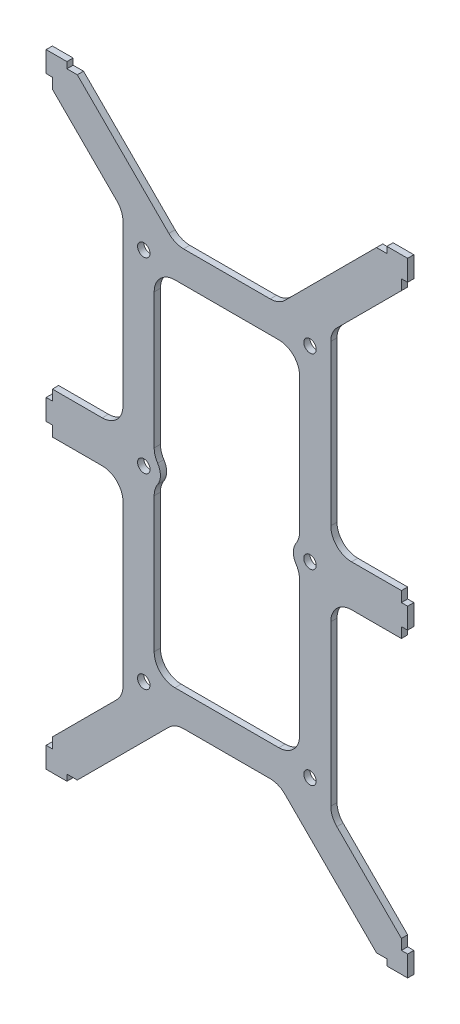
from build123d import *

# Parameters (mm, degrees)
SZKIC1_R                    = 3
DODANIE_WYCI_GNI_CIE1_DEPTH = 3


with BuildPart() as part:
    # Szkic1 → Dodanie-wyciągnięcie1 (new body)
    with BuildSketch(Plane.XY):
        with BuildLine():
            Line((-551.440279355, 234.881586878), (-551.440279355, 224.881586878))
            Line((-551.440279355, 224.881586878), (-548.440279355, 224.881586878))
            Line((-548.440279355, 224.881586878), (-548.440279355, 219.881586878))
            Line((-548.440279355, 219.881586878), (-517.369211543, 188.810519066))
            ThreePointArc((-517.369211543, 188.810519066), (-515.20148403, 185.566285578), (-514.440279355, 181.739451254))
            Line((-514.440279355, 181.739451254), (-514.440279355, 104.881586878))
            ThreePointArc((-514.440279355, 104.881586878), (-517.369211543, 97.810519066), (-524.440279355, 94.881586878))
            Line((-524.440279355, 94.881586878), (-548.440279355, 94.881586878))
            Line((-548.440279355, 94.881586878), (-548.440279355, 89.881586878))
            Line((-548.440279355, 89.881586878), (-551.440279355, 89.881586878))
            Line((-551.440279355, 89.881586878), (-551.440279355, 84.881586878))
            Line((-551.440279355, 84.881586878), (-551.440279355, 79.881586878))
            Line((-551.440279355, 79.881586878), (-548.440279355, 79.881586878))
            Line((-548.440279355, 79.881586878), (-548.440279355, 74.881586878))
            Line((-548.440279355, 74.881586878), (-524.440279355, 74.881586878))
            ThreePointArc((-524.440279355, 74.881586878), (-517.369211543, 71.95265469), (-514.440279355, 64.881586878))
            Line((-514.440279355, 64.881586878), (-514.440279355, -11.976277498))
            ThreePointArc((-514.440279355, -11.976277498), (-515.20148403, -15.803111822), (-517.369211543, -19.04734531))
            Line((-517.369211543, -19.04734531), (-548.440279355, -50.118413122))
            Line((-548.440279355, -50.118413122), (-548.440279355, -55.118413122))
            Line((-548.440279355, -55.118413122), (-551.440279355, -55.118413122))
            Line((-551.440279355, -55.118413122), (-551.440279355, -65.118413122))
            Line((-551.440279355, -65.118413122), (-541.440279355, -65.118413122))
            Line((-541.440279355, -65.118413122), (-541.440279355, -62.118413122))
            Line((-541.440279355, -62.118413122), (-536.440279355, -62.118413122))
            Line((-536.440279355, -62.118413122), (-492.369211543, -18.04734531))
            ThreePointArc((-492.369211543, -18.04734531), (-489.124978055, -15.879617797), (-485.298143731, -15.118413122))
            Line((-485.298143731, -15.118413122), (-464.440279355, -15.118413122))
            Line((-464.440279355, -15.118413122), (-443.582414979, -15.118413122))
            ThreePointArc((-443.582414979, -15.118413122), (-439.755580655, -15.879617797), (-436.511347167, -18.04734531))
            Line((-436.511347167, -18.04734531), (-392.440279355, -62.118413122))
            Line((-392.440279355, -62.118413122), (-387.440279355, -62.118413122))
            Line((-387.440279355, -62.118413122), (-387.440279355, -65.118413122))
            Line((-387.440279355, -65.118413122), (-377.440279355, -65.118413122))
            Line((-377.440279355, -65.118413122), (-377.440279355, -55.118413122))
            Line((-377.440279355, -55.118413122), (-380.440279355, -55.118413122))
            Line((-380.440279355, -55.118413122), (-380.440279355, -50.118413122))
            Line((-380.440279355, -50.118413122), (-411.511347167, -19.04734531))
            ThreePointArc((-411.511347167, -19.04734531), (-413.67907468, -15.803111822), (-414.440279355, -11.976277498))
            Line((-414.440279355, -11.976277498), (-414.440279355, 64.881586878))
            ThreePointArc((-414.440279355, 64.881586878), (-411.511347167, 71.95265469), (-404.440279355, 74.881586878))
            Line((-404.440279355, 74.881586878), (-380.440279355, 74.881586878))
            Line((-380.440279355, 74.881586878), (-380.440279355, 79.881586878))
            Line((-380.440279355, 79.881586878), (-377.440279355, 79.881586878))
            Line((-377.440279355, 79.881586878), (-377.440279355, 84.881586878))
            Line((-377.440279355, 84.881586878), (-377.440279355, 89.881586878))
            Line((-377.440279355, 89.881586878), (-380.440279355, 89.881586878))
            Line((-380.440279355, 89.881586878), (-380.440279355, 94.881586878))
            Line((-380.440279355, 94.881586878), (-404.440279355, 94.881586878))
            ThreePointArc((-404.440279355, 94.881586878), (-411.511347167, 97.810519066), (-414.440279355, 104.881586878))
            Line((-414.440279355, 104.881586878), (-414.440279355, 181.739451254))
            ThreePointArc((-414.440279355, 181.739451254), (-413.67907468, 185.566285578), (-411.511347167, 188.810519066))
            Line((-411.511347167, 188.810519066), (-380.440279355, 219.881586878))
            Line((-380.440279355, 219.881586878), (-380.440279355, 224.881586878))
            Line((-380.440279355, 224.881586878), (-377.440279355, 224.881586878))
            Line((-377.440279355, 224.881586878), (-377.440279355, 234.881586878))
            Line((-377.440279355, 234.881586878), (-387.440279355, 234.881586878))
            Line((-387.440279355, 234.881586878), (-387.440279355, 231.881586878))
            Line((-387.440279355, 231.881586878), (-392.440279355, 231.881586878))
            Line((-392.440279355, 231.881586878), (-436.511347167, 187.810519066))
            ThreePointArc((-436.511347167, 187.810519066), (-439.755580655, 185.642791553), (-443.582414979, 184.881586878))
            Line((-443.582414979, 184.881586878), (-464.440279355, 184.881586878))
            Line((-464.440279355, 184.881586878), (-485.298143731, 184.881586878))
            ThreePointArc((-485.298143731, 184.881586878), (-489.124978055, 185.642791553), (-492.369211543, 187.810519066))
            Line((-492.369211543, 187.810519066), (-536.440279355, 231.881586878))
            Line((-536.440279355, 231.881586878), (-541.440279355, 231.881586878))
            Line((-541.440279355, 231.881586878), (-541.440279355, 234.881586878))
            Line((-541.440279355, 234.881586878), (-551.440279355, 234.881586878))
        make_face()
        with Locations((-504.440279355, 174.881586878)):
            Circle(SZKIC1_R, mode=Mode.SUBTRACT)
        with Locations((-424.440279355, 174.881586878)):
            Circle(SZKIC1_R, mode=Mode.SUBTRACT)
        with Locations((-504.440279355, -5.118413122)):
            Circle(SZKIC1_R, mode=Mode.SUBTRACT)
        with Locations((-424.440279355, -5.118413122)):
            Circle(SZKIC1_R, mode=Mode.SUBTRACT)
        with BuildLine():
            Line((-499.440279355, 159.881586878), (-499.440279355, 94.831461249))
            ThreePointArc((-499.440279355, 94.831461249), (-499.014550433, 91.944709903), (-497.773612688, 89.303753265))
            ThreePointArc((-497.773612688, 89.303753265), (-496.780862493, 87.190987955), (-496.440279355, 84.881586878))
            ThreePointArc((-496.440279355, 84.881586878), (-496.780862493, 82.572185801), (-497.773612688, 80.459420491))
            ThreePointArc((-497.773612688, 80.459420491), (-499.014550433, 77.818463853), (-499.440279355, 74.931712507))
            Line((-499.440279355, 74.931712507), (-499.440279355, 9.881586878))
            ThreePointArc((-499.440279355, 9.881586878), (-496.511347167, 2.810519066), (-489.440279355, -0.118413122))
            Line((-489.440279355, -0.118413122), (-464.440279355, -0.118413122))
            Line((-464.440279355, -0.118413122), (-439.440279355, -0.118413122))
            ThreePointArc((-439.440279355, -0.118413122), (-432.369211543, 2.810519066), (-429.440279355, 9.881586878))
            Line((-429.440279355, 9.881586878), (-429.440279355, 74.931712507))
            ThreePointArc((-429.440279355, 74.931712507), (-429.866008277, 77.818463853), (-431.106946022, 80.459420491))
            ThreePointArc((-431.106946022, 80.459420491), (-432.099696217, 82.572185801), (-432.440279355, 84.881586878))
            ThreePointArc((-432.440279355, 84.881586878), (-432.099696217, 87.190987955), (-431.106946022, 89.303753265))
            ThreePointArc((-431.106946022, 89.303753265), (-429.866008277, 91.944709903), (-429.440279355, 94.831461249))
            Line((-429.440279355, 94.831461249), (-429.440279355, 159.881586878))
            ThreePointArc((-429.440279355, 159.881586878), (-432.369211543, 166.95265469), (-439.440279355, 169.881586878))
            Line((-439.440279355, 169.881586878), (-464.440279355, 169.881586878))
            Line((-464.440279355, 169.881586878), (-489.440279355, 169.881586878))
            ThreePointArc((-489.440279355, 169.881586878), (-496.511347167, 166.95265469), (-499.440279355, 159.881586878))
        make_face(mode=Mode.SUBTRACT)
        with BuildLine():
            ThreePointArc((-501.440279355, 84.881586878), (-504.440279355, 87.881586878), (-507.440279355, 84.881586878))
            ThreePointArc((-507.440279355, 84.881586878), (-504.440279355, 81.881586878), (-501.440279355, 84.881586878))
        make_face(mode=Mode.SUBTRACT)
        with BuildLine():
            ThreePointArc((-421.440279355, 84.881586878), (-424.440279355, 87.881586878), (-427.440279355, 84.881586878))
            ThreePointArc((-427.440279355, 84.881586878), (-424.440279355, 81.881586878), (-421.440279355, 84.881586878))
        make_face(mode=Mode.SUBTRACT)
    extrude(amount=DODANIE_WYCI_GNI_CIE1_DEPTH)


solid = part.part
